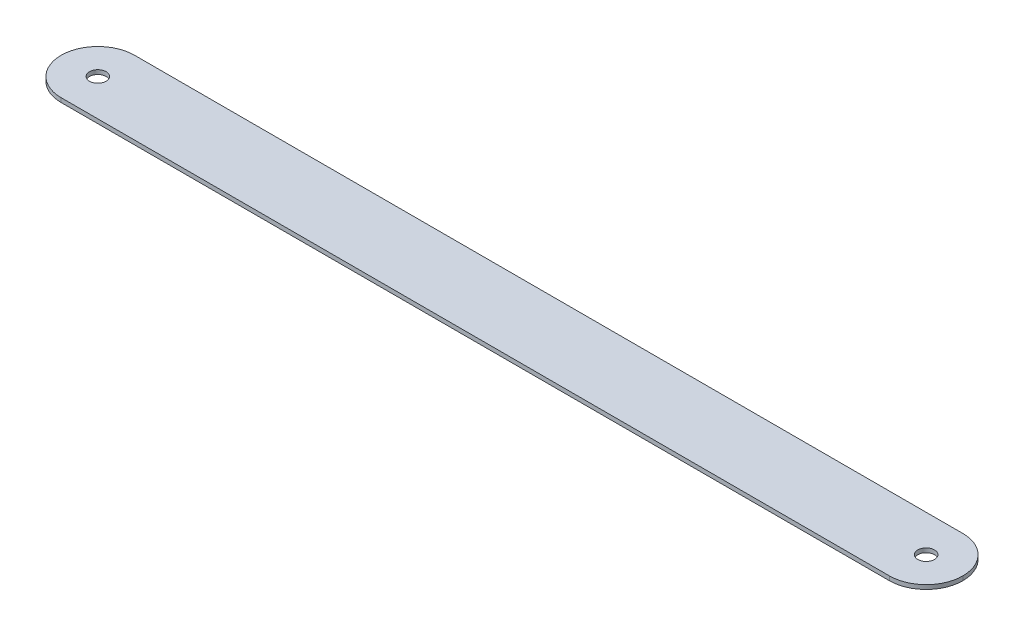
from build123d import *

# Parameters (mm, degrees)
SKETCH2_W                = 184.15
SKETCH2_H                = 15
BASE_FLANGE1_DEPTH       = 0.86
M3_CLEARANCE_HOLE1_D     = 3.4
M3_CLEARANCE_HOLE1_DEPTH = 1.29
M3_CLEARANCE_HOLE1_TIP   = 1.021463052
FILLET1_R                = 7.5


# Sheet-metal steps are written as plain solids
with BuildPart() as part:
    # Sketch2 → Base-Flange1 (new body)
    with BuildSketch(Plane(origin=(0, 0, 0), x_dir=(1, 0, 0), z_dir=(0, 1, 0))):
        Rectangle(SKETCH2_W, SKETCH2_H)
    extrude(amount=-BASE_FLANGE1_DEPTH)

    # M3 Clearance Hole1
    with Locations(Plane(origin=(0, 0, 0), x_dir=(1, 0, 0), z_dir=(0, 1, 0))):
        with Locations((-84.575, 0), (84.575, 0)):
            Hole(M3_CLEARANCE_HOLE1_D / 2, depth=M3_CLEARANCE_HOLE1_DEPTH)
            with Locations((0, 0, -(M3_CLEARANCE_HOLE1_DEPTH + M3_CLEARANCE_HOLE1_TIP / 2))):  # 118° drill point
                Cone(0, M3_CLEARANCE_HOLE1_D / 2, M3_CLEARANCE_HOLE1_TIP, mode=Mode.SUBTRACT)

    # Fillet1
    fillet1_edges = [part.edges().sort_by_distance(p)[0] for p in [
        (92.075, -0.43, 7.5),
        (92.075, -0.43, -7.5),
        (-92.075, -0.43, 7.5),
        (-92.075, -0.43, -7.5),
    ]]
    fillet(fillet1_edges, radius=FILLET1_R - 0.0001)  # a hair under: the kernel refuses the full size


solid = part.part
